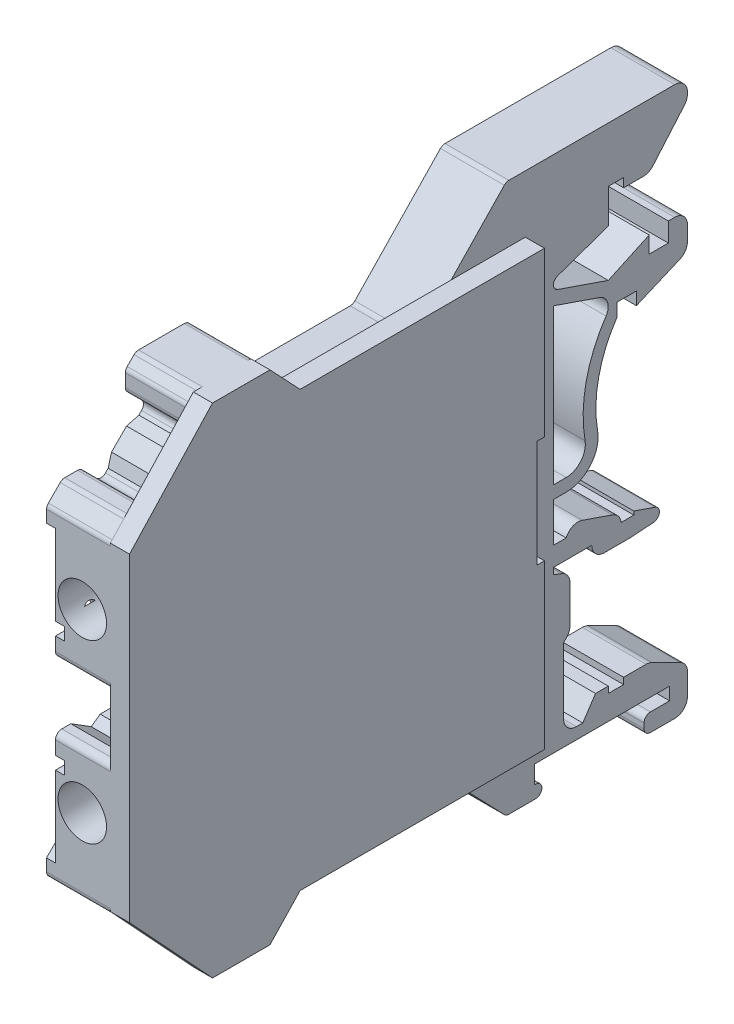
from build123d import *
from OCP.BRepFilletAPI import BRepFilletAPI_MakeChamfer

# Parameters (mm, degrees)
SKETCH2_W                = 45.2
SKETCH2_H                = 43
BOSS_EXTRUDE1_DEPTH      = 2.5
CUT_EXTRUDE1_DEPTH       = 12.5
CUT_EXTRUDE2_DEPTH       = 12.5
CUT_EXTRUDE3_DEPTH       = 32.293130237
CUT_EXTRUDE3_DEPTH_BACK  = 32.293130237
SKETCH6_W                = 18
SKETCH6_H                = 5
CHAMFER1_SIZE            = 1
SKETCH8_R                = 1.9
CUT_EXTRUDE4_DEPTH       = 25
BOSS_EXTRUDE2_DEPTH      = 5
CHAMFER2_SIZE            = 0.5
CHAMFER2_SIZE_2          = 0.866025404
CHAMFER3_SIZE            = 0.5
CHAMFER3_SIZE_2          = 0.866025404
SKETCH10_W               = 5.5
SKETCH10_H               = 6
CUT_EXTRUDE5_DEPTH       = 25
CUT_EXTRUDE6_DEPTH       = 10
SKETCH12_W               = 22
SKETCH12_H               = 18.7
CUT_EXTRUDE7_DEPTH       = 0.7
CUT_EXTRUDE9_DEPTH       = 1.4
CUT_EXTRUDE10_DEPTH      = 32.293130309
CUT_EXTRUDE10_DEPTH_BACK = 32.293130309
SKETCH14_W               = 1.2
SKETCH14_H               = 34.4
CUT_EXTRUDE11_DEPTH      = 7
BOSS_EXTRUDE3_DEPTH      = 5
CUT_EXTRUDE12_DEPTH      = 7
BOSS_EXTRUDE4_DEPTH      = 5
SKETCH20_W               = 8
SKETCH20_H               = 4.523750774
SKETCH20_W_2             = 10
SKETCH20_H_2             = 1
CUT_EXTRUDE13_DEPTH      = 7
FILLET1_R                = 1
SKETCH21_W               = 5
SKETCH21_H               = 2
CUT_EXTRUDE14_DEPTH      = 2
CUT_EXTRUDE15_DEPTH      = 1.5
CHAMFER4_SIZE            = 2
CHAMFER4_SIZE2           = 1.154700538
SKETCH23_W               = 22.2
SKETCH23_H               = 3
BOSS_EXTRUDE5_DEPTH      = 1
SKETCH24_W               = 2
SKETCH24_H               = 3.5
BOSS_EXTRUDE6_DEPTH      = 3
CHAMFER5_SIZE            = 2
CUT_EXTRUDE16_DEPTH      = 32.388851596
CUT_EXTRUDE16_DEPTH_BACK = 32.388851596
SKETCH25_W               = 0.590234316
SKETCH25_H               = 1.4
FILLET2_R                = 0.5
BOSS_EXTRUDE7_DEPTH      = 1.5


# Some blends are built 0.0001 mm under size
with BuildPart() as part:
    # Sketch2 → Boss-Extrude1 (new, symmetric)
    with BuildSketch(Plane(origin=(0, 0, 0), x_dir=(0, 0, -1), z_dir=(1, 0, 0))):
        Rectangle(SKETCH2_W, SKETCH2_H)
    extrude(amount=BOSS_EXTRUDE1_DEPTH, both=True)

    # Sketch3 → Cut-Extrude1 (cut, symmetric)
    with BuildSketch(Plane(origin=(0, 0, 0), x_dir=(0, 0, -1), z_dir=(1, 0, 0))):
        Polygon((-22.6, 12.5), (-22.6, -12.5), (-15.6, -19.5), (-11.6, -19.5), (-6.6, -14.2), (1.4, -14.2), (8.4, -21.5), (15.934924346, -21.5), (15.934924346, -44.619502155), (-57.470164159, -44.619502155), (-57.470164159, 44.619502155), (15.934924346, 44.619502155), (15.934924346, 21.5), (8.4, 21.5), (1.4, 14.2), (-6.6, 14.2), (-11.6, 19.5), (-15.6, 19.5), align=None)
    extrude(amount=CUT_EXTRUDE1_DEPTH, both=True, mode=Mode.SUBTRACT)

    # Sketch4 → Cut-Extrude2 (cut, symmetric)
    with BuildSketch(Plane(origin=(2.5, 0, 0), x_dir=(0, 0, -1), z_dir=(1, 0, 0))):
        Polygon((-19.774658841, 20.603591029), (-14.802081528, 15.631013716), (-18.337615434, 12.09547981), (-23.310192747, 17.068057123), align=None)
        Polygon((-23.310192747, -17.068057123), (-18.337615434, -12.09547981), (-14.802081528, -15.631013716), (-19.774658841, -20.603591029), align=None)
    extrude(amount=CUT_EXTRUDE2_DEPTH, both=True, mode=Mode.SUBTRACT)

    # Sketch6 → Cut-Extrude3 (cut, two sides: drawn at the far end of the back side and taken through both)
    with BuildSketch(Plane(origin=(0, 0, 0), x_dir=(0, 0, -1), z_dir=(1, 0, 0)).offset(-CUT_EXTRUDE3_DEPTH_BACK)):
        with Locations((-22.6, 0)):
            Rectangle(SKETCH6_W, SKETCH6_H)
    extrude(amount=CUT_EXTRUDE3_DEPTH + CUT_EXTRUDE3_DEPTH_BACK, mode=Mode.SUBTRACT)

    # Chamfer1
    chamfer1_edges = [part.edges().sort_by_distance(p)[0] for p in [
        (0, -14.428932188, 20.671067812),
        (0, -17.964466094, 17.135533906),
        (0, 14.428932188, 20.671067812),
        (0, 17.964466094, 17.135533906),
    ]]
    chamfer(chamfer1_edges, length=CHAMFER1_SIZE)

    # Sketch8 → Cut-Extrude4 (cut)
    with BuildSketch(Plane.XY.offset(22.6)):
        with Locations((0.3, 6.9)):
            Circle(SKETCH8_R)
        with Locations((0.3, -6.9)):
            Circle(SKETCH8_R)
    extrude(amount=-CUT_EXTRUDE4_DEPTH, mode=Mode.SUBTRACT)

    # Sketch9 → Boss-Extrude2 (add)
    with BuildSketch(Plane(origin=(2.5, 0, 0), x_dir=(0, 0, -1), z_dir=(1, 0, 0))):
        Polygon((-15.721320344, 15.418881682), (-18.1254834, 13.014718626), (-17.418376618, 12.307611845), (-15.014213562, 14.711774901), align=None)
        Polygon((-15.014213562, -14.711774901), (-17.418376618, -12.307611845), (-18.1254834, -13.014718626), (-15.721320344, -15.418881682), align=None)
    extrude(amount=-BOSS_EXTRUDE2_DEPTH)

    # Chamfer2
    chamfer2_edges_1 = [part.edges().sort_by_distance(p)[0] for p in [
        (0, -13.014718626, 18.1254834),
    ]]
    chamfer2_side_1 = [part.faces().sort_by_distance(p)[0] for p in [
        (0, -13.007647558, 18.118412332),
    ]]
    chamfer2_edges_2 = [part.edges().sort_by_distance(p)[0] for p in [
        (0, 15.418881682, 15.721320344),
    ]]
    chamfer2_side_2 = [part.faces().sort_by_distance(p)[0] for p in [
        (0, 15.411810614, 15.714249276),
    ]]
    chamfer2 = BRepFilletAPI_MakeChamfer(part.part.solid().wrapped)
    for e in chamfer2_edges_1:
        chamfer2.Add(CHAMFER2_SIZE - 0.0001, CHAMFER2_SIZE_2 - 0.0001, e.wrapped, chamfer2_side_1[0].wrapped)
    for e in chamfer2_edges_2:
        chamfer2.Add(CHAMFER2_SIZE - 0.0001, CHAMFER2_SIZE_2 - 0.0001, e.wrapped, chamfer2_side_2[0].wrapped)
    add(Compound.cast(chamfer2.Shape()), mode=Mode.REPLACE)  # a hair under: the kernel refuses the full size

    # Chamfer3
    chamfer3_edges_1 = [part.edges().sort_by_distance(p)[0] for p in [
        (0, 13.014718626, 18.1254834),
    ]]
    chamfer3_side_1 = [part.faces().sort_by_distance(p)[0] for p in [
        (0, 13.007647558, 18.118412332),
    ]]
    chamfer3_edges_2 = [part.edges().sort_by_distance(p)[0] for p in [
        (0, -15.418881682, 15.721320344),
    ]]
    chamfer3_side_2 = [part.faces().sort_by_distance(p)[0] for p in [
        (0, -15.411810614, 15.728391411),
    ]]
    chamfer3 = BRepFilletAPI_MakeChamfer(part.part.solid().wrapped)
    for e in chamfer3_edges_1:
        chamfer3.Add(CHAMFER3_SIZE - 0.0001, CHAMFER3_SIZE_2 - 0.0001, e.wrapped, chamfer3_side_1[0].wrapped)
    for e in chamfer3_edges_2:
        chamfer3.Add(CHAMFER3_SIZE_2 - 0.0001, CHAMFER3_SIZE - 0.0001, e.wrapped, chamfer3_side_2[0].wrapped)
    add(Compound.cast(chamfer3.Shape()), mode=Mode.REPLACE)  # a hair under: the kernel refuses the full size

    # Sketch10 → Cut-Extrude5 (cut)
    with BuildSketch(Plane.ZY.offset(2.5)):
        with Locations((16.35, 0)):
            Rectangle(SKETCH10_W, SKETCH10_H)
    extrude(amount=-CUT_EXTRUDE5_DEPTH, mode=Mode.SUBTRACT)

    # Sketch11 → Cut-Extrude6 (cut)
    with BuildSketch(Plane(origin=(2.5, 0, 0), x_dir=(0, 0, -1), z_dir=(1, 0, 0))):
        Polygon((-19.1, -3), (-19.8, -3.5), (-21.4, -2.5), (-21.4, 2.5), (-19.8, 3.5), (-19.1, 3), align=None)
    extrude(amount=-CUT_EXTRUDE6_DEPTH, mode=Mode.SUBTRACT)

    # Sketch12 → Cut-Extrude7 (cut)
    with BuildSketch(Plane.ZY.offset(2.5)):
        with Locations((22.6, 0)):
            Rectangle(SKETCH12_W, SKETCH12_H)
    extrude(amount=-CUT_EXTRUDE7_DEPTH, mode=Mode.SUBTRACT)

    # Sketch13 → Cut-Extrude9 (cut)
    with BuildSketch(Plane.ZY.offset(2.5)):
        with BuildLine():
            Line((19.967544468, 4.75), (16.9, 4.75))
            Line((16.9, 4.75), (13, 4.75))
            Line((13, 4.75), (13, 4.05))
            Line((13, 4.05), (32.2, 4.05))
            Line((32.2, 4.05), (32.2, 4.75))
            Line((32.2, 4.75), (21.232455532, 4.75))
            ThreePointArc((21.232455532, 4.75), (20.6, 4.35), (19.967544468, 4.75))
        make_face()
        with BuildLine():
            Line((16.9, 5.05), (16.9, 4.75))
            Line((16.9, 4.75), (19.967544468, 4.75))
            ThreePointArc((19.967544468, 4.75), (19.917094856, 4.896245118), (19.9, 5.05))
            Line((19.9, 5.05), (16.9, 5.05))
        make_face()
        with BuildLine():
            ThreePointArc((19.9, 5.05), (19.917094856, 4.896245118), (19.967544468, 4.75))
            Line((19.967544468, 4.75), (21.232455532, 4.75))
            ThreePointArc((21.232455532, 4.75), (21.282905144, 4.896245118), (21.3, 5.05))
            Line((21.3, 5.05), (19.9, 5.05))
        make_face()
        with BuildLine():
            Line((21.232455532, 4.75), (19.967544468, 4.75))
            ThreePointArc((19.967544468, 4.75), (20.6, 4.35), (21.232455532, 4.75))
        make_face()
        with BuildLine():
            ThreePointArc((21.3, 5.05), (21.282905144, 4.896245118), (21.232455532, 4.75))
            Line((21.232455532, 4.75), (32.2, 4.75))
            Line((32.2, 4.75), (32.2, 5.05))
            Line((32.2, 5.05), (21.3, 5.05))
        make_face()
        with BuildLine():
            ThreePointArc((21.3, 5.05), (20.6, 5.75), (19.9, 5.05))
            Line((19.9, 5.05), (21.3, 5.05))
        make_face()
        with BuildLine():
            Line((32.2, -4.75), (32.2, -4.05))
            Line((32.2, -4.05), (13, -4.05))
            Line((13, -4.05), (13, -4.75))
            Line((13, -4.75), (16.9, -4.75))
            Line((16.9, -4.75), (19.967544468, -4.75))
            ThreePointArc((19.967544468, -4.75), (20.6, -4.35), (21.232455532, -4.75))
            Line((21.232455532, -4.75), (32.2, -4.75))
        make_face()
        with BuildLine():
            Line((32.2, -5.05), (32.2, -4.75))
            Line((32.2, -4.75), (21.232455532, -4.75))
            ThreePointArc((21.232455532, -4.75), (21.282905144, -4.896245118), (21.3, -5.05))
            Line((21.3, -5.05), (32.2, -5.05))
        make_face()
        with BuildLine():
            ThreePointArc((21.3, -5.05), (21.282905144, -4.896245118), (21.232455532, -4.75))
            Line((21.232455532, -4.75), (19.967544468, -4.75))
            ThreePointArc((19.967544468, -4.75), (19.917094856, -4.896245118), (19.9, -5.05))
            Line((19.9, -5.05), (21.3, -5.05))
        make_face()
        with BuildLine():
            Line((19.967544468, -4.75), (21.232455532, -4.75))
            ThreePointArc((21.232455532, -4.75), (20.6, -4.35), (19.967544468, -4.75))
        make_face()
        with BuildLine():
            Line((19.967544468, -4.75), (16.9, -4.75))
            Line((16.9, -4.75), (16.9, -5.05))
            Line((16.9, -5.05), (19.9, -5.05))
            ThreePointArc((19.9, -5.05), (19.917094856, -4.896245118), (19.967544468, -4.75))
        make_face()
        with BuildLine():
            ThreePointArc((19.9, -5.05), (20.6, -5.75), (21.3, -5.05))
            Line((21.3, -5.05), (19.9, -5.05))
        make_face()
    extrude(amount=-CUT_EXTRUDE9_DEPTH, mode=Mode.SUBTRACT)

    # Sketch14 → Cut-Extrude10 (cut, two sides: drawn at the far end of the back side and taken through both)
    with BuildSketch(Plane(origin=(0, 0, 0), x_dir=(0, 0, -1), z_dir=(1, 0, 0)).offset(-CUT_EXTRUDE10_DEPTH_BACK)):
        with Locations((17, 0)):
            Rectangle(SKETCH14_W, SKETCH14_H)
    extrude(amount=CUT_EXTRUDE10_DEPTH + CUT_EXTRUDE10_DEPTH_BACK, mode=Mode.SUBTRACT)

    # Sketch15 → Cut-Extrude11 (cut)
    with BuildSketch(Plane(origin=(2.5, 0, 0), x_dir=(0, 0, -1), z_dir=(1, 0, 0))):
        Polygon((22.6, 20), (19.6, 16.5), (17.6, 16.5), (16.4, 16.5), (16.4, 14.5), (12.1, 13), (12.1, -7), (13.4, -7.5), (13.4, -11.5), (12.9, -12), (12.9, -16.7), (58.723410829, -16.7), (58.723410829, 20), align=None)
    extrude(amount=-CUT_EXTRUDE11_DEPTH, mode=Mode.SUBTRACT)

    # Sketch16 → Boss-Extrude3 (add)
    with BuildSketch(Plane(origin=(2.5, 0, 0), x_dir=(0, 0, -1), z_dir=(1, 0, 0))):
        with BuildLine():
            Line((12.1, 12.3), (16.4, 10.819391263))
            Line((16.4, 10.819391263), (19.6, 12.3))
            Line((19.6, 12.3), (19.6, 11))
            Line((19.6, 11), (21.1, 11))
            Line((21.1, 11), (21.1, 12.5))
            Line((21.1, 12.5), (22.6, 12.5))
            Line((22.6, 12.5), (22.6, 9.7))
            Line((22.6, 9.7), (18.6, 8))
            Line((18.6, 8), (18.6, 9))
            Line((18.6, 9), (17.1, 9))
            Line((17.1, 9), (17.1, 8))
            ThreePointArc((17.1, 8), (15.650888398, 4.660192581), (15.564367928, 1.020583777))
            ThreePointArc((15.564367928, 1.020583777), (15.010688285, -1.012225257), (13.1, -1.9))
            Line((13.1, -1.9), (12.1, -1.9))
            Line((12.1, -1.9), (12.1, 12.3))
        make_face()
    extrude(amount=-BOSS_EXTRUDE3_DEPTH)

    # Sketch17 → Cut-Extrude12 (cut)
    with BuildSketch(Plane(origin=(2.5, 0, 0), x_dir=(0, 0, -1), z_dir=(1, 0, 0))):
        with BuildLine():
            Line((12.1, -0.9), (13.1, -0.9))
            ThreePointArc((13.1, -0.9), (14.246412971, -0.367335154), (14.578620757, 0.852350266))
            ThreePointArc((14.578620757, 0.852350266), (14.66451639, 4.830379182), (16.224404881, 8.49082178))
            ThreePointArc((16.224404881, 8.49082178), (16.343731716, 9.367339485), (15.720967209, 9.995580322))
            Line((15.720967209, 9.995580322), (12.1, 11.242379319))
            Line((12.1, 11.242379319), (12.1, -0.9))
        make_face()
    extrude(amount=-CUT_EXTRUDE12_DEPTH, mode=Mode.SUBTRACT)

    # Sketch18 → Boss-Extrude4 (add)
    with BuildSketch(Plane(origin=(2.5, 0, 0), x_dir=(0, 0, -1), z_dir=(1, 0, 0))):
        with BuildLine():
            Line((12.1, -5), (13.1, -5))
            Line((13.1, -5), (13.1, -4))
            Line((13.1, -4), (17.4, -5.480608737))
            Line((17.4, -5.480608737), (17.4, -6.1))
            Line((17.4, -6.1), (18.4, -6.1))
            Line((18.4, -6.1), (18.4, -5.82493635))
            Line((18.4, -5.82493635), (20.067045643, -6.398946198))
            ThreePointArc((20.067045643, -6.398946198), (20.4, -6.936846909), (19.939384642, -7.37047033))
            Line((19.939384642, -7.37047033), (18.1, -7.5))
            Line((18.1, -7.5), (15.1, -7.5))
            Line((15.1, -7.5), (15.1, -6.5))
            Line((15.1, -6.5), (12.1, -6.5))
            Line((12.1, -6.5), (12.1, -5))
        make_face()
    extrude(amount=-BOSS_EXTRUDE4_DEPTH)

    # Sketch20 → Cut-Extrude13 (cut)
    with BuildSketch(Plane(origin=(2.5, 0, 0), x_dir=(0, 0, -1), z_dir=(1, 0, 0))):
        Polygon((14.4, -18.2), (15.4, -16.7), (12.9, -16.7), (12.9, -18.2), align=None)
        Polygon((22.6, -18.2), (22.6, -16.7), (19.6, -16.7), align=None)
        with Locations((15.2, -22.361875387)):
            Rectangle(SKETCH20_W, SKETCH20_H)
        with Locations((16.2, -19.6)):
            Rectangle(SKETCH20_W_2, SKETCH20_H_2)
    extrude(amount=-CUT_EXTRUDE13_DEPTH, mode=Mode.SUBTRACT)

    # Fillet1
    # the kernel refuses this fillet: 1 mm, written as the material it adds along each edge
    with BuildSketch(Plane(origin=(2.5, -18.2, -12.9), x_dir=(0, 0, -1), z_dir=(-1, 0, 0))) as fillet1_piece_1:
        with BuildLine():
            CenterArc((FILLET1_R, -FILLET1_R), FILLET1_R, 90, 90)
            Line((0, -FILLET1_R), (0, 0))
            Line((0, 0), (FILLET1_R, 0))
        make_face()
    extrude(amount=5)
    # the kernel refuses this fillet: 1 mm, written as the material it takes off along each edge
    with BuildSketch(Plane(origin=(5, 12.5, -22.6), x_dir=(0, 0, 1), z_dir=(-1, 0, 0)), Plane(origin=(5, 21.5, -22.6), x_dir=(0, 0, 1), z_dir=(-1, 0, 0)), Plane(origin=(5, -7.5, -15.1), x_dir=(0, 0, -1), z_dir=(-1, 0, 0)), Plane(origin=(5, -21.5, -22.6), x_dir=(0, 1, 0), z_dir=(-1, 0, 0))) as fillet1_2_piece_1:
        with BuildLine():
            CenterArc((FILLET1_R, -FILLET1_R), FILLET1_R, 90, 90)
            Line((0, -FILLET1_R), (0, 0))
            Line((0, 0), (FILLET1_R, 0))
        make_face()
    extrude(amount=10, mode=Mode.SUBTRACT)
    with BuildSketch(Plane(origin=(4.153914227, 9.7, -22.6), x_dir=(0, 1, 0), z_dir=(-1, 0, 0))) as fillet1_2_piece_2:
        with BuildLine():
            CenterArc((FILLET1_R * 0.661565690605, -FILLET1_R), FILLET1_R, 90, 66.974507991)
            Line((-FILLET1_R * 0.258765227853, -FILLET1_R * 0.608859359655), (0, 0))
            Line((0, 0), (FILLET1_R * 0.661565690605, 0))
        make_face()
    extrude(amount=8.307828453, mode=Mode.SUBTRACT)
    with BuildSketch(Plane(origin=(3.649837306, 16.5, -19.6), x_dir=(0, 0.7592566023652949, -0.6507913734559704), z_dir=(-1, 0, 0))) as fillet1_2_piece_3:
        with BuildLine():
            CenterArc((FILLET1_R * 0.45993492247, -FILLET1_R), FILLET1_R, 90, 49.398705355)
            Line((-FILLET1_R * 0.299321679895, -FILLET1_R * 0.349208626544), (0, 0))
            Line((0, 0), (FILLET1_R * 0.45993492247, 0))
        make_face()
    extrude(amount=7.299674612, mode=Mode.SUBTRACT)
    with BuildSketch(Plane(origin=(3.424810191, 20, -22.6), x_dir=(0, 1, 0), z_dir=(-1, 0, 0))) as fillet1_2_piece_4:
        with BuildLine():
            CenterArc((FILLET1_R * 0.369924076216, -FILLET1_R), FILLET1_R, 90, 40.601294645)
            Line((-FILLET1_R * 0.28086729724, -FILLET1_R * 0.240743397635), (0, 0))
            Line((0, 0), (FILLET1_R * 0.369924076215, 0))
        make_face()
    extrude(amount=6.849620381, mode=Mode.SUBTRACT)
    with BuildSketch(Plane(origin=(5.810207347, -4, -13.1), x_dir=(0, -1, 0), z_dir=(-1, 0, 0))) as fillet1_2_piece_5:
        with BuildLine():
            CenterArc((1.376597814, -0.92637686), FILLET1_R, 112.123101993, 86.876898007)
            Line((0.431079239, -1.251945014), (0, 0))
            Line((0, 0), (1, 0))
        make_face()
    extrude(amount=11.620414694, mode=Mode.SUBTRACT)
    with BuildSketch(Plane(origin=(4.271154252, -5.480608737, -17.4), x_dir=(0, 0.325568154457152, 0.9455185755993185), z_dir=(-1, 0, 0))) as fillet1_2_piece_6:
        with BuildLine():
            CenterArc((0.708461701, -1), FILLET1_R, 90, 65.521355137)
            Line((-0.20165407, -0.585645945), (0, 0))
            Line((0, 0), (0.708461701, 0))
        make_face()
    extrude(amount=8.542308504, mode=Mode.SUBTRACT)
    with BuildSketch(Plane(origin=(4.216997746, -7.5, -13.4), x_dir=(0, 0.3589790793089369, 0.9333456062030334), z_dir=(-1, 0, 0))) as fillet1_2_piece_7:
        with BuildLine():
            CenterArc((FILLET1_R * 0.686799098245, -FILLET1_R), FILLET1_R, 90, 68.962488975)
            Line((-FILLET1_R * 0.246546507958, -FILLET1_R * 0.641020920691), (0, 0))
            Line((0, 0), (FILLET1_R * 0.686799098245, 0))
        make_face()
    extrude(amount=8.433995491, mode=Mode.SUBTRACT)
    with BuildSketch(Plane(origin=(3.535533906, -11.5, -13.4), x_dir=(0, 1, 0), z_dir=(-1, 0, 0))) as fillet1_2_piece_8:
        with BuildLine():
            CenterArc((FILLET1_R * 0.414213562373, -FILLET1_R), FILLET1_R, 90, 45)
            Line((-FILLET1_R * 0.292893218813, -FILLET1_R * 0.292893218813), (0, 0))
            Line((0, 0), (FILLET1_R * 0.414213562373, 0))
        make_face()
    extrude(amount=7.071067812, mode=Mode.SUBTRACT)
    with BuildSketch(Plane(origin=(4.045084972, -18.2, -22.6), x_dir=(0, 0.4472135954999602, 0.8944271909999147), z_dir=(-1, 0, 0))) as fillet1_2_piece_9:
        with BuildLine():
            CenterArc((FILLET1_R * 0.61803398875, -FILLET1_R), FILLET1_R, 90, 63.434948823)
            Line((-FILLET1_R * 0.27639320225, -FILLET1_R * 0.5527864045), (0, 0))
            Line((0, 0), (FILLET1_R * 0.61803398875, 0))
        make_face()
    extrude(amount=8.090169944, mode=Mode.SUBTRACT)
    with BuildSketch(Plane(origin=(3.090169944, -16.7, -19.6), x_dir=(0, 0, 1), z_dir=(-1, 0, 0))) as fillet1_2_piece_10:
        with BuildLine():
            CenterArc((FILLET1_R * 0.2360679775, -FILLET1_R), FILLET1_R, 90, 26.565051177)
            Line((-FILLET1_R * 0.211145618, -FILLET1_R * 0.105572809), (0, 0))
            Line((0, 0), (FILLET1_R * 0.2360679775, 0))
        make_face()
    extrude(amount=6.180339887, mode=Mode.SUBTRACT)

    # Sketch21 → Cut-Extrude14 (cut)
    with BuildSketch(Plane.ZY.offset(2.5)):
        with Locations((-14.6, 19.2)):
            Rectangle(SKETCH21_W, SKETCH21_H)
        Polygon((-12.1, 14.059097445), (-12.1, 18.2), (-15.4, 18.2), (-15.4, 17.2), (-15.4, 15.210260236), align=None)
    extrude(amount=-CUT_EXTRUDE14_DEPTH, mode=Mode.SUBTRACT)

    # Sketch22 → Cut-Extrude15 (cut)
    with BuildSketch(Plane.ZY.offset(2.5)):
        Polygon((-3.6, 15.04944973), (-8.826555053, 20.5), (-11.1, 20.5), (-11.1, -20.5), (-8.826555053, -20.5), (-3.6, -15.04944973), align=None)
    extrude(amount=-CUT_EXTRUDE15_DEPTH, mode=Mode.SUBTRACT)

    # Chamfer4
    chamfer4_edges = [part.edges().sort_by_distance(p)[0] for p in [
        (-1, 0, -3.6),
    ]]
    chamfer4_side = [part.faces().sort_by_distance(p)[0] for p in [
        (-1, 0, -7.555001041),
    ]]
    chamfer(chamfer4_edges, length=CHAMFER4_SIZE, length2=CHAMFER4_SIZE2, reference=chamfer4_side[0])

    # Sketch23 → Boss-Extrude5 (add)
    with BuildSketch(Plane.ZY.offset(1)):
        Rectangle(SKETCH23_W, SKETCH23_H)
    extrude(amount=BOSS_EXTRUDE5_DEPTH)

    # Sketch24 → Boss-Extrude6 (add)
    with BuildSketch(Plane.ZY.offset(2.5)):
        with Locations((-3.6, 10.5)):
            Rectangle(SKETCH24_W, SKETCH24_H)
        with Locations((-3.6, -10.5)):
            Rectangle(SKETCH24_W, SKETCH24_H)
    extrude(amount=-BOSS_EXTRUDE6_DEPTH)

    # Chamfer5
    chamfer5_edges = [part.edges().sort_by_distance(p)[0] for p in [
        (-2.15, 9.35, 22.6),
        (-2.15, 9.35, 11.6),
        (-2.15, -9.35, 22.6),
        (-2.15, -9.35, 11.6),
    ]]
    chamfer(chamfer5_edges, length=CHAMFER5_SIZE)

    # Sketch25 → Cut-Extrude16 (cut, two sides: drawn at the far end of the back side and taken through both)
    with BuildSketch(Plane.ZY.offset(1).offset(-CUT_EXTRUDE16_DEPTH_BACK)):
        with Locations((-10.904882842, -19.8)):
            Rectangle(SKETCH25_W, SKETCH25_H)
    extrude(amount=CUT_EXTRUDE16_DEPTH + CUT_EXTRUDE16_DEPTH_BACK, mode=Mode.SUBTRACT)

    # Fillet2
    # the kernel refuses this fillet: 0.5 mm, written as the material it adds along each edge
    with BuildSketch(Plane(origin=(2.5, -15.631013716, 14.802081528), x_dir=(0, -0.7071067811865493, 0.7071067811865458), z_dir=(-1, 0, 0)), Plane(origin=(2.5, -12.09547981, 18.337615434), x_dir=(0, -0.7071067811865476, -0.7071067811865476), z_dir=(-1, 0, 0)), Plane(origin=(2.5, 12.09547981, 18.337615434), x_dir=(0, 0.7071067811865476, 0.7071067811865476), z_dir=(-1, 0, 0)), Plane(origin=(2.5, 15.631013716, 14.802081528), x_dir=(0, -0.7071067811865458, 0.7071067811865493), z_dir=(-1, 0, 0))) as fillet2_piece_1:
        with BuildLine():
            CenterArc((FILLET2_R, FILLET2_R), FILLET2_R, 180, 90)
            Line((0, FILLET2_R), (0, 0))
            Line((0, 0), (FILLET2_R, 0))
        make_face()
    extrude(amount=5)
    with BuildSketch(Plane(origin=(2.5, 14.2, 6.6), x_dir=(0, 0.7273936525094618, 0.6862204268957199), z_dir=(-1, 0, 0))) as fillet2_piece_2:
        with BuildLine():
            CenterArc((FILLET2_R * 0.431375187317, FILLET2_R), FILLET2_R, 223.331662552, 46.668337448)
            Line((-FILLET2_R * 0.296018465193, FILLET2_R * 0.313779573104), (0, 0))
            Line((0, 0), (FILLET2_R * 0.431375187317, 0))
        make_face()
    extrude(amount=5)
    with BuildSketch(Plane(origin=(2.5, 14.2, -1.4), x_dir=(0, 0, 1), z_dir=(-1, 0, 0)), Plane(origin=(2.5, -14.2, -1.4), x_dir=(0, -0.7217823714725234, -0.6921200822339287), z_dir=(-1, 0, 0))) as fillet2_piece_3:
        with BuildLine():
            CenterArc((FILLET2_R * 0.426555053067, FILLET2_R), FILLET2_R, 223.798166936, 46.201833064)
            Line((-FILLET2_R * 0.295227318406, FILLET2_R * 0.307879917766), (0, 0))
            Line((0, 0), (FILLET2_R * 0.426555053067, 0))
        make_face()
    extrude(amount=5)
    with BuildSketch(Plane(origin=(2.5, 13, -12.1), x_dir=(0, 0.32937215631831435, -0.9442001814457694), z_dir=(-1, 0, 0))) as fillet2_piece_4:
        with BuildLine():
            CenterArc((FILLET2_R * 0.710260235975, FILLET2_R), FILLET2_R, 199.230672376, 70.769327624)
            Line((-FILLET2_R * 0.23393994547, FILLET2_R * 0.670627843682), (0, 0))
            Line((0, 0), (FILLET2_R * 0.710260235975, 0))
        make_face()
    extrude(amount=5)
    with BuildSketch(Plane(origin=(2.5, 12.3, -12.1), x_dir=(0, 1, 0), z_dir=(-1, 0, 0))) as fillet2_piece_5:
        with BuildLine():
            CenterArc((FILLET2_R * 0.713293067897, FILLET2_R), FILLET2_R, 199, 71)
            Line((-FILLET2_R * 0.232225507702, FILLET2_R * 0.674431845543), (0, 0))
            Line((0, 0), (FILLET2_R * 0.713293067897, 0))
        make_face()
    extrude(amount=5)
    # the kernel refuses this fillet: 0.5 mm, written as the material it takes off along each edge
    with BuildSketch(Plane(origin=(3.75, -2.5, 22.6), x_dir=(0, -1, 0), z_dir=(-1, 0, 0)), Plane(origin=(-3.05, 2.5, 22.6), x_dir=(0, 1, 0), z_dir=(1, 0, 0))) as fillet2_2_piece_1:
        with BuildLine():
            CenterArc((FILLET2_R, -FILLET2_R), FILLET2_R, 90, 90)
            Line((0, -FILLET2_R), (0, 0))
            Line((0, 0), (FILLET2_R, 0))
        make_face()
    extrude(amount=6.8, mode=Mode.SUBTRACT)
    with BuildSketch(Plane(origin=(3.017766953, -17.257359313, 16.428427125), x_dir=(0, 0.707106781186539, -0.7071067811865561), z_dir=(-1, 0, 0)), Plane(origin=(3.017766953, -19.5, 15.6), x_dir=(0, 0.7071067811865518, 0.7071067811865432), z_dir=(-1, 0, 0)), Plane(origin=(3.017766953, -18.671572875, 16.428427125), x_dir=(0, 1, 0), z_dir=(-1, 0, 0)), Plane(origin=(3.017766953, -12.5, 22.6), x_dir=(0, 1, 0), z_dir=(-1, 0, 0)), Plane(origin=(-3.017766953, 12.5, 22.6), x_dir=(0, -1.0, 1.3208594701746958e-12), z_dir=(1, 0, 0)), Plane(origin=(3.017766953, 13.721825407, 21.378174593), x_dir=(0, 0, -1), z_dir=(-1, 0, 0)), Plane(origin=(3.017766953, 13.721825407, 19.963961031), x_dir=(0, -0.7071067811865518, -0.7071067811865432), z_dir=(-1, 0, 0))) as fillet2_2_piece_2:
        with BuildLine():
            CenterArc((FILLET2_R * 0.414213562373, FILLET2_R), FILLET2_R, 225, 45)
            Line((-FILLET2_R * 0.292893218813, FILLET2_R * 0.292893218813), (0, 0))
            Line((0, 0), (FILLET2_R * 0.414213562373, 0))
        make_face()
    extrude(amount=6.035533906, mode=Mode.SUBTRACT)
    with BuildSketch(Plane(origin=(3.039218984, -19.5, 11.6), x_dir=(0, 0, 1), z_dir=(-1, 0, 0))) as fillet2_2_piece_3:
        with BuildLine():
            CenterArc((FILLET2_R * 0.431375187317, FILLET2_R), FILLET2_R, 223.331662552, 46.668337448)
            Line((-FILLET2_R * 0.296018465193, FILLET2_R * 0.313779573104), (0, 0))
            Line((0, 0), (FILLET2_R * 0.431375187317, 0))
        make_face()
    extrude(amount=6.078437968, mode=Mode.SUBTRACT)
    with BuildSketch(Plane(origin=(-3.017766953, -13.721825407, 19.963961031), x_dir=(0, 0, 1), z_dir=(1, 0, 0)), Plane(origin=(-3.017766953, -13.721825407, 21.378174593), x_dir=(0, 0.7071067811865475, 0.7071067811865475), z_dir=(1, 0, 0)), Plane(origin=(-3.017766953, 17.257359313, 16.428427125), x_dir=(0, 1, 0), z_dir=(1, 0, 0)), Plane(origin=(-3.017766953, 18.671572875, 16.428427125), x_dir=(0, 0.7071067811865561, -0.707106781186539), z_dir=(1, 0, 0)), Plane(origin=(-3.017766953, 19.5, 15.6), x_dir=(0, 0, -1), z_dir=(1, 0, 0))) as fillet2_2_piece_4:
        with BuildLine():
            CenterArc((FILLET2_R * 0.414213562373, -FILLET2_R), FILLET2_R, 90, 45)
            Line((-FILLET2_R * 0.292893218813, -FILLET2_R * 0.292893218813), (0, 0))
            Line((0, 0), (FILLET2_R * 0.414213562373, 0))
        make_face()
    extrude(amount=6.035533906, mode=Mode.SUBTRACT)
    with BuildSketch(Plane(origin=(-3.039218984, 19.5, 11.6), x_dir=(0, -0.7273936525094638, -0.6862204268957182), z_dir=(1, 0, 0))) as fillet2_2_piece_5:
        with BuildLine():
            CenterArc((FILLET2_R * 0.431375187317, -FILLET2_R), FILLET2_R, 90, 46.668337448)
            Line((-FILLET2_R * 0.296018465193, -FILLET2_R * 0.313779573104), (0, 0))
            Line((0, 0), (FILLET2_R * 0.431375187317, 0))
        make_face()
    extrude(amount=6.078437968, mode=Mode.SUBTRACT)
    with BuildSketch(Plane(origin=(3.033193816, 21.5, -8.4), x_dir=(0, 0, -1), z_dir=(-1, 0, 0)), Plane(origin=(3.033193816, -21.5, -8.4), x_dir=(0, 0.7217823714725264, 0.6921200822339254), z_dir=(-1, 0, 0))) as fillet2_2_piece_6:
        with BuildLine():
            CenterArc((FILLET2_R * 0.426555053067, FILLET2_R), FILLET2_R, 223.798166936, 46.201833064)
            Line((-FILLET2_R * 0.295227318406, FILLET2_R * 0.307879917766), (0, 0))
            Line((0, 0), (FILLET2_R * 0.426555053067, 0))
        make_face()
    extrude(amount=6.066387633, mode=Mode.SUBTRACT)
    with BuildSketch(Plane(origin=(-3.75, -21.5, -11.2), x_dir=(0, 0, 1), z_dir=(1, 0, 0))) as fillet2_2_piece_7:
        with BuildLine():
            CenterArc((FILLET2_R, -FILLET2_R), FILLET2_R, 90, 90)
            Line((0, -FILLET2_R), (0, 0))
            Line((0, 0), (FILLET2_R, 0))
        make_face()
    extrude(amount=7.5, mode=Mode.SUBTRACT)
    with BuildSketch(Plane(origin=(3.75, -20.5, -11.2), x_dir=(0, -1, 0), z_dir=(-1, 0, 0)), Plane(origin=(3.75, -20.1, -19.2), x_dir=(0, 0, -1), z_dir=(-1, 0, 0)), Plane(origin=(3.75, -21.5, -19.2), x_dir=(0, 1, 0), z_dir=(-1, 0, 0))) as fillet2_2_piece_8:
        with BuildLine():
            CenterArc((FILLET2_R, FILLET2_R), FILLET2_R, 180, 90)
            Line((0, FILLET2_R), (0, 0))
            Line((0, 0), (FILLET2_R, 0))
        make_face()
    extrude(amount=7.5, mode=Mode.SUBTRACT)

    # Sketch26 → Boss-Extrude7 (add)
    with BuildSketch(Plane(origin=(2.5, 0, 0), x_dir=(0, 0, -1), z_dir=(1, 0, 0))):
        Polygon((-16.1, 19.5), (-22.6, 12.5), (-22.6, -12.5), (-16.1, -19.5), (-11.6, -19.5), (-9.241509434, -17), (9.9, -17), (9.9, -4.2), (9.3, -4.2), (9.3, 4.2), (9.9, 4.2), (9.9, 17), (-9.241509434, 17), (-11.6, 19.5), align=None)
    extrude(amount=BOSS_EXTRUDE7_DEPTH)


solid = part.part
